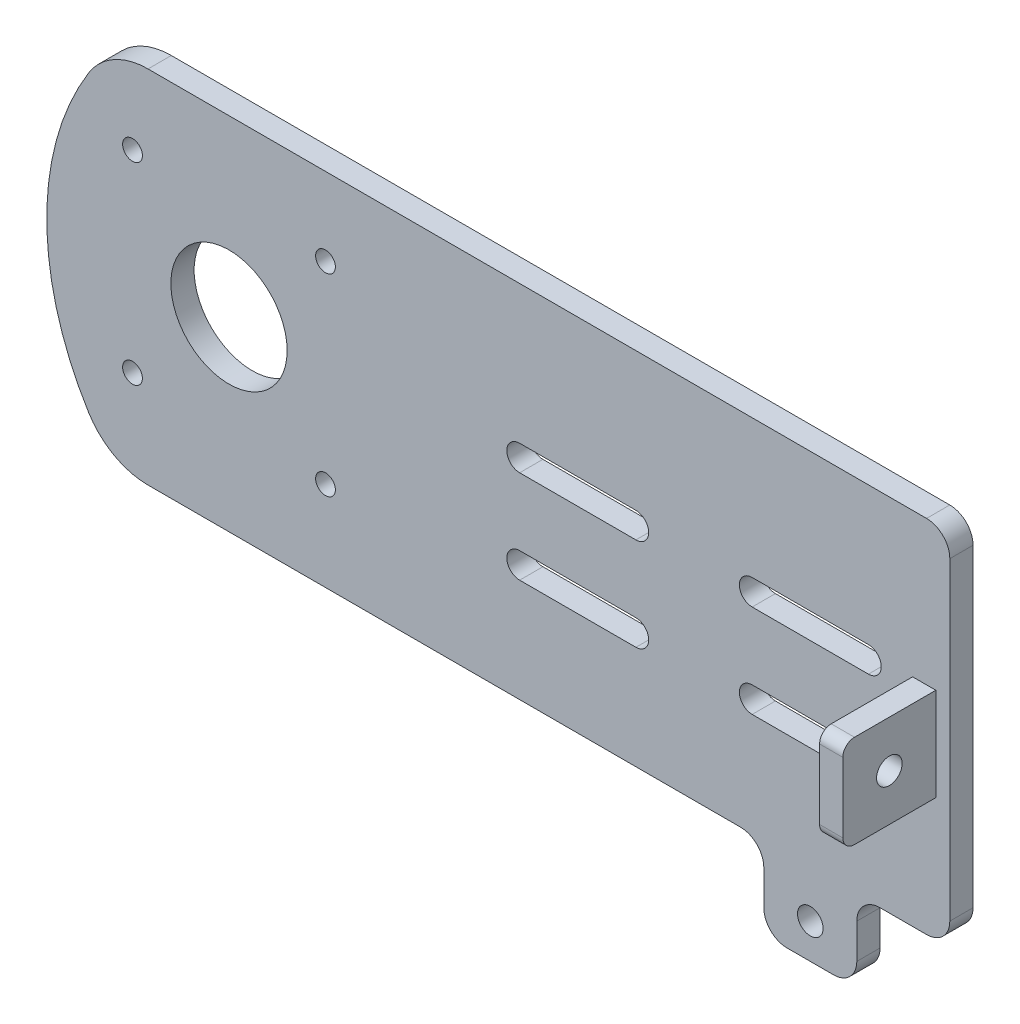
from build123d import *

# Parameters (mm, degrees)
TABAN_FLAN_1_DEPTH          = 10
IZIM2_R                     = 25
IZIM2_R_2                   = 4.25
KES_EKSTR_ZYON1_DEPTH       = 10
IZIM3_R                     = 5.5
KES_EKSTR_ZYON2_DEPTH       = 20
IZIM4_W                     = 10
IZIM4_H                     = 40
Y_KSEKLIK_EKSTR_ZYON1_DEPTH = 40
IZIM5_R                     = 5.5
KES_EKSTR_ZYON3_DEPTH       = 40
RADYUS3_R                   = 5
RADYUS5_R                   = 10
RADYUS6_R                   = 30
RADYUS7_R                   = 10


# Sheet-metal steps are written as plain solids
with BuildPart() as part:
    # Çizim1 → Taban-Flanş1 (new body)
    with BuildSketch(Plane.XY):
        with BuildLine():
            Line((-360, -70), (-250, -70))
            Line((-250, -70), (-200, -70))
            Line((-200, -70), (-80, -70))
            Line((-80, -70), (-80, -105))
            Line((-80, -105), (-40, -105))
            Line((-40, -105), (-40, -70))
            Line((-40, -70), (0, -70))
            Line((0, -70), (0, 0))
            Line((0, 0), (0, 85))
            Line((0, 85), (-360, 85))
            ThreePointArc((-360, 85), (-388.382588991, 7.5), (-360, -70))
        make_face()
    extrude(amount=-TABAN_FLAN_1_DEPTH)

    # Çizim2 → Kes-Ekstrüzyon1 (cut)
    with BuildSketch(Plane.XY):
        with Locations((-310, 10)):
            Circle(IZIM2_R)
        with Locations((-351.5, 51.5)):
            Circle(IZIM2_R_2)
        with Locations((-268.5, 51.5)):
            Circle(IZIM2_R_2)
        with Locations((-351.5, -31.5)):
            Circle(IZIM2_R_2)
        with Locations((-268.5, -31.5)):
            Circle(IZIM2_R_2)
        with BuildLine():
            Line((-85, 25.5), (-35, 25.5))
            ThreePointArc((-35, 25.5), (-29.5, 20), (-35, 14.5))
            Line((-35, 14.5), (-85, 14.5))
            ThreePointArc((-85, 14.5), (-90.5, 20), (-85, 25.5))
        make_face()
        with BuildLine():
            Line((-85, -14.5), (-35, -14.5))
            ThreePointArc((-35, -14.5), (-29.5, -20), (-35, -25.5))
            Line((-35, -25.5), (-85, -25.5))
            ThreePointArc((-85, -25.5), (-90.5, -20), (-85, -14.5))
        make_face()
        with BuildLine():
            Line((-185, 25.5), (-135, 25.5))
            ThreePointArc((-135, 25.5), (-129.5, 20), (-135, 14.5))
            Line((-135, 14.5), (-185, 14.5))
            ThreePointArc((-185, 14.5), (-190.5, 20), (-185, 25.5))
        make_face()
        with BuildLine():
            Line((-185, -14.5), (-135, -14.5))
            ThreePointArc((-135, -14.5), (-129.5, -20), (-135, -25.5))
            Line((-135, -25.5), (-185, -25.5))
            ThreePointArc((-185, -25.5), (-190.5, -20), (-185, -14.5))
        make_face()
    extrude(amount=-KES_EKSTR_ZYON1_DEPTH, mode=Mode.SUBTRACT)

    # Çizim3 → Kes-Ekstrüzyon2 (cut)
    with BuildSketch(Plane.XY):
        with Locations((-60, -90)):
            Circle(IZIM3_R)
    extrude(amount=-KES_EKSTR_ZYON2_DEPTH, mode=Mode.SUBTRACT)

    # Radyus5
    radyus5_edges = [part.edges().sort_by_distance(p)[0] for p in [
        (-40, -70, -5),
        (-40, -105, -5),
        (-80, -105, -5),
        (-80, -70, -5),
    ]]
    fillet(radyus5_edges, radius=RADYUS5_R)

    # Radyus6
    radyus6_edges = [part.edges().sort_by_distance(p)[0] for p in [
        (-360, -70, -5),
        (-360, 85, -5),
    ]]
    fillet(radyus6_edges, radius=RADYUS6_R)

    # Radyus7
    radyus7_edges = [part.edges().sort_by_distance(p)[0] for p in [
        (0, -70, -5),
        (0, 85, -5),
    ]]
    fillet(radyus7_edges, radius=RADYUS7_R)


with BuildPart() as body_2:
    # Çizim4 → Yükseklik-Ekstrüzyon1 (new body)
    with BuildSketch(Plane.XY):
        with Locations((-11, 3)):
            Rectangle(IZIM4_W, IZIM4_H)
    extrude(amount=Y_KSEKLIK_EKSTR_ZYON1_DEPTH)

    # Çizim5 → Kes-Ekstrüzyon3 (cut)
    with BuildSketch(Plane(origin=(-6, 0, 0), x_dir=(0, 0, -1), z_dir=(1, 0, 0))):
        with Locations(Location((-20, 3, 0), (0, 0, 90))):
            Circle(IZIM5_R)
    extrude(amount=-KES_EKSTR_ZYON3_DEPTH, mode=Mode.SUBTRACT)

    # Radyus3
    radyus3_edges = [body_2.edges().sort_by_distance(p)[0] for p in [
        (-11, -17, 40),
        (-11, 23, 40),
    ]]
    fillet(radyus3_edges, radius=RADYUS3_R)


solid = Compound([part.part, body_2.part])
